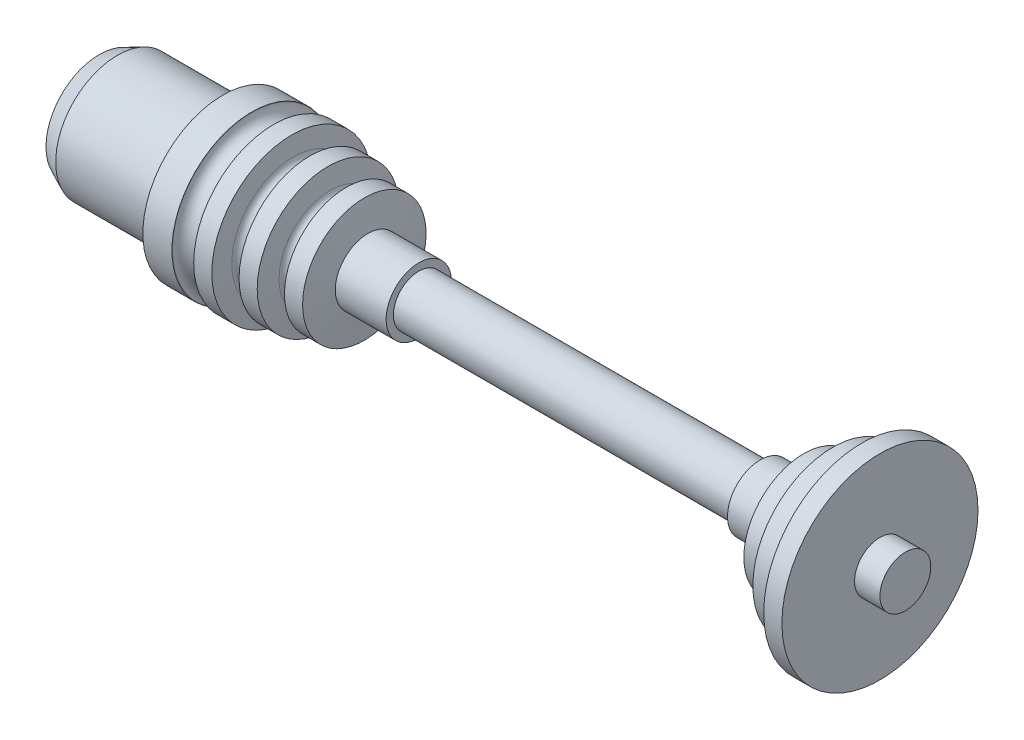
from build123d import *

# Parameters (mm, degrees)
SKETCH1_R           = 1.7
BOSS_EXTRUDE1_DEPTH = 2.9
SKETCH2_R           = 2.2
BOSS_EXTRUDE2_DEPTH = 0.8
SKETCH4_R           = 0.7
BOSS_EXTRUDE3_DEPTH = 9.4
BOSS_EXTRUDE4_START = 1.2
SKETCH5_R           = 0.9
BOSS_EXTRUDE4_DEPTH = 1.2


# Read off the part's stored shape, not the designer's step: Revolve2, Boss-Extrude5
with BuildPart() as part:
    # Sketch1 → Boss-Extrude1 (new body)
    with BuildSketch(Plane(origin=(0, 0, 0), x_dir=(0, 0, -1), z_dir=(1, 0, 0))):
        Circle(SKETCH1_R)
    extrude(amount=BOSS_EXTRUDE1_DEPTH)

    # Sketch2 → Boss-Extrude2 (add)
    with BuildSketch(Plane(origin=(2.9, 0, 0), x_dir=(0, 0, -1), z_dir=(1, 0, 0))):
        Circle(SKETCH2_R)
    extrude(amount=BOSS_EXTRUDE2_DEPTH)

    # Revolve2 outline → Revolve2 (revolve)
    with BuildSketch(Plane.YX):
        with BuildLine():
            Line((1.7, 6.298399372), (1.7, 6.798399372))
            Line((1.7, 6.798399372), (0.9, 6.897812865))
            Line((0.9, 6.897812865), (0.9, 8.297812865))
            Line((0.9, 8.297812865), (0, 8.297812865))
            Line((0, 8.297812865), (0, 3.7))
            Line((0, 3.7), (2.184467787, 3.7))
            ThreePointArc((2.184467787, 3.7), (1.892233893, 4.007766107), (2.2, 4.3))
            Line((2.2, 4.3), (2.2, 4.798399372))
            Line((2.2, 4.798399372), (1.7, 4.846675418))
            ThreePointArc((1.7, 4.846675418), (1.514074869, 5.051416625), (1.7, 5.256157831))
            Line((1.7, 5.256157831), (1.95, 5.298399372))
            Line((1.95, 5.298399372), (1.95, 5.798399372))
            Line((1.95, 5.798399372), (1.409586795, 5.859069124))
            ThreePointArc((1.409586795, 5.859069124), (1.241888768, 6.046647338), (1.409586795, 6.234225552))
            Line((1.409586795, 6.234225552), (1.7, 6.298399372))
        make_face()
    revolve(axis=Axis((0, 0, 0), (1, 0, 0)))

    # Sketch4 → Boss-Extrude3 (add)
    with BuildSketch(Plane(origin=(8.297812865, 0, 0), x_dir=(0, 0, -1), z_dir=(1, 0, 0))):
        Circle(SKETCH4_R)
    extrude(amount=BOSS_EXTRUDE3_DEPTH)

    # Sketch5 → Boss-Extrude4 (add)
    with BuildSketch(Plane(origin=(17.697812865, 0, 0), x_dir=(0, 0, -1), z_dir=(1, 0, 0)).offset(BOSS_EXTRUDE4_START)):
        with Locations(Location((0, 0, 0), (0, 0, 180))):
            Circle(SKETCH5_R)
    extrude(amount=-BOSS_EXTRUDE4_DEPTH)

    # Sketch7 → Revolve3 (revolve)
    with BuildSketch(Plane.XY, mode=Mode.PRIVATE) as revolve3_sk:
        with BuildLine():
            Line((18.897812865, 1.65), (19.397812865, 1.65))
            Line((19.397812865, 1.65), (19.480088718, 1.012798991))
            ThreePointArc((19.480088718, 1.012798991), (19.539543647, 0.954346514), (19.610445316, 0.998216024))
            Line((19.610445316, 0.998216024), (19.694861948, 2.2))
            Line((19.694861948, 2.2), (20.194861948, 2.2))
            Line((20.194861948, 2.2), (20.292775797, 0.858303662))
            ThreePointArc((20.292775797, 0.858303662), (20.359991739, 0.78583442), (20.445426465, 0.83554037))
            Line((20.445426465, 0.83554037), (20.494861948, 2.7))
            Line((20.494861948, 2.7), (20.994861948, 2.7))
            Line((20.994861948, 2.7), (20.994861948, 0.7))
            Line((20.994861948, 0.7), (21.694861948, 0.7))
            Line((21.694861948, 0.7), (21.694861948, 0))
            Line((21.694861948, 0), (18.897812865, 0))
            Line((18.897812865, 0), (18.897812865, 1.65))
        make_face()
    revolve(revolve3_sk.sketch.rotate(Axis((-29.131286685, 0, 0), (1, 0, 0)), 90), axis=Axis((-29.131286685, 0, 0), (1, 0, 0)))

    # Boss-Extrude5 outline → Boss-Extrude5 (revolve)
    with BuildSketch(Plane.YX):
        Polygon((0, 0), (0, -0.5), (1.466846171, -0.5), (1.7, 0), align=None)
    revolve(axis=Axis((0, 0, 0), (1, 0, 0)))


solid = part.part
